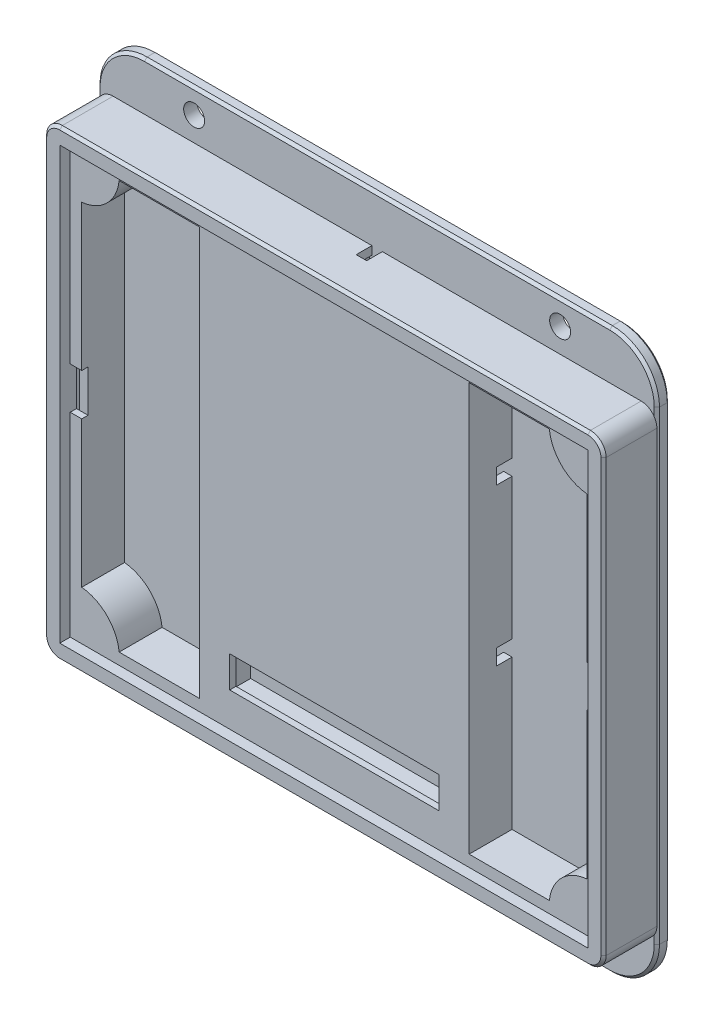
from build123d import *

# Parameters (mm, degrees)
SKETCH1_W                 = 107
SKETCH1_H                 = 88.5
SKETCH1_W_2               = 101
SKETCH1_H_2               = 82.5
BOSS_EXTRUDE1_DEPTH       = 2
FILLET1_R                 = 3
CHAMFER1_SIZE             = 0.5
SKETCH2_W                 = 8
SKETCH2_H                 = 8
SKETCH2_W_2               = 40
SKETCH2_H_2               = 6
BOSS_EXTRUDE2_DEPTH       = 1.2
BOSS_EXTRUDE3_DEPTH       = 7
EXTRUDE_THIN1_OUTLINE_W   = 48.4
EXTRUDE_THIN1_OUTLINE_H   = 21
EXTRUDE_THIN1_OUTLINE_H_2 = 5.75
EXTRUDE_THIN1_OUTLINE_H_3 = 12.4
EXTRUDE_THIN1_DEPTH       = 7
SKETCH6_R                 = 1.4
BOSS_EXTRUDE4_DEPTH       = 7
MIRROR2_COPY_1_SKETCH_R   = 1.4
MIRROR2_COPY_1_DEPTH      = 7
EXTRUDE_THIN2_DEPTH       = 7
SKETCH10_W                = 51.6
SKETCH10_H                = 1.6
BOSS_EXTRUDE5_DEPTH       = 7
SKETCH11_W                = 51.6
SKETCH11_H                = 2
CUT_EXTRUDE1_DEPTH        = 7
CUT_EXTRUDE2_DEPTH        = 70.780459299
EXTRUDE_THIN3_DEPTH       = 4
FILLET2_R                 = 1.6
SKETCH14_R                = 1.5
SKETCH14_R_2              = 1.8
BOSS_EXTRUDE6_DEPTH       = 2.5
CHAMFER2_SIZE             = 0.5
SKETCH15_W                = 2
SKETCH15_H                = 3
CUT_EXTRUDE3_DEPTH        = 14
SKETCH16_W                = 107
SKETCH16_H                = 107
SKETCH16_R                = 2
BOSS_EXTRUDE7_DEPTH       = 2.5
FILLET3_R                 = 9
CHAMFER3_SIZE             = 0.5
SKETCH17_W                = 1.6
SKETCH17_H                = 3
CUT_EXTRUDE4_DEPTH        = 3
SKETCH18_W                = 3
SKETCH18_H                = 4
CUT_EXTRUDE5_DEPTH        = 1.2
CHAMFER4_SIZE             = 1.5


# Read off the part's stored shape, not the designer's step: Extrude-Thin1, DeleteFace1
with BuildPart() as part:
    # Sketch1 → Boss-Extrude1 (new body)
    with BuildSketch(Plane.XY):
        Rectangle(SKETCH1_W, SKETCH1_H)
        Rectangle(SKETCH1_W_2, SKETCH1_H_2, mode=Mode.SUBTRACT)
    extrude(amount=BOSS_EXTRUDE1_DEPTH)

    # Fillet1
    fillet1_edges = [part.edges().sort_by_distance(p)[0] for p in [
        (-53.5, 44.25, 1),
        (53.5, 44.25, 1),
        (53.5, -44.25, 1),
        (-53.5, -44.25, 1),
    ]]
    fillet(fillet1_edges, radius=FILLET1_R)

    # Chamfer1
    chamfer1_edges = [part.edges().sort_by_distance(p)[0] for p in [
        (53.5, 0, 2),
        (0, -44.25, 2),
        (-53.5, 0, 2),
        (0, 44.25, 2),
        (52.621320344, 43.371320344, 2),
        (-52.621320344, 43.371320344, 2),
        (-52.621320344, -43.371320344, 2),
        (52.621320344, -43.371320344, 2),
    ]]
    chamfer(chamfer1_edges, length=CHAMFER1_SIZE)

    # Sketch2 → Boss-Extrude2 (add)
    with BuildSketch(Plane(origin=(0, 0, 0), x_dir=(-1, 0, 0), z_dir=(0, 0, -1))):
        with BuildLine():
            Line((-53.5, 41.25), (-53.5, -41.25))
            ThreePointArc((-53.5, -41.25), (-52.621320344, -43.371320344), (-50.5, -44.25))
            Line((-50.5, -44.25), (50.5, -44.25))
            ThreePointArc((50.5, -44.25), (52.621320344, -43.371320344), (53.5, -41.25))
            Line((53.5, -41.25), (53.5, 41.25))
            ThreePointArc((53.5, 41.25), (52.621320344, 43.371320344), (50.5, 44.25))
            Line((50.5, 44.25), (-50.5, 44.25))
            ThreePointArc((-50.5, 44.25), (-52.621320344, 43.371320344), (-53.5, 41.25))
        make_face()
        with Locations((-46.5, 0)):
            Rectangle(SKETCH2_W, SKETCH2_H, mode=Mode.SUBTRACT)
        with Locations((46.5, 0)):
            Rectangle(SKETCH2_W, SKETCH2_H, mode=Mode.SUBTRACT)
        with Locations((0, -31.75)):
            Rectangle(SKETCH2_W_2, SKETCH2_H_2, mode=Mode.SUBTRACT)
    extrude(amount=BOSS_EXTRUDE2_DEPTH)

    # Sketch3 → Boss-Extrude3 (add)
    with BuildSketch(Plane(origin=(0, 0, -1.2), x_dir=(-1, 0, 0), z_dir=(0, 0, -1))):
        with BuildLine():
            Line((-53.5, 41.25), (-53.5, -41.25))
            ThreePointArc((-53.5, -41.25), (-52.621320344, -43.371320344), (-50.5, -44.25))
            Line((-50.5, -44.25), (50.5, -44.25))
            ThreePointArc((50.5, -44.25), (52.621320344, -43.371320344), (53.5, -41.25))
            Line((53.5, -41.25), (53.5, 41.25))
            ThreePointArc((53.5, 41.25), (52.621320344, 43.371320344), (50.5, 44.25))
            Line((50.5, 44.25), (-50.5, 44.25))
            ThreePointArc((-50.5, 44.25), (-52.621320344, 43.371320344), (-53.5, 41.25))
        make_face()
        with BuildLine():
            Line((50.5, 42.65), (-50.5, 42.65))
            ThreePointArc((-50.5, 42.65), (-51.489949494, 42.239949494), (-51.9, 41.25))
            Line((-51.9, 41.25), (-51.9, -41.25))
            ThreePointArc((-51.9, -41.25), (-51.489949494, -42.239949494), (-50.5, -42.65))
            Line((-50.5, -42.65), (50.5, -42.65))
            ThreePointArc((50.5, -42.65), (51.489949494, -42.239949494), (51.9, -41.25))
            Line((51.9, -41.25), (51.9, 41.25))
            ThreePointArc((51.9, 41.25), (51.489949494, 42.239949494), (50.5, 42.65))
        make_face(mode=Mode.SUBTRACT)
    extrude(amount=BOSS_EXTRUDE3_DEPTH)

    # Extrude-Thin1 outline → Extrude-Thin1 (add)
    with BuildSketch(Plane(origin=(0, 0, -1.2), x_dir=(-1, 0, 0), z_dir=(0, 0, -1))):
        Polygon((24.2, 42.65), (24.2, 33.45), (-24.2, 33.45), (-24.2, 42.65), (-25.8, 42.65), (-25.8, -42.65), (-24.2, -42.65), (-24.2, -12.1), (24.2, -12.1), (24.2, -42.65), (25.8, -42.65), (25.8, 42.65), align=None)
        Rectangle(EXTRUDE_THIN1_OUTLINE_W, EXTRUDE_THIN1_OUTLINE_H, mode=Mode.SUBTRACT)
        with Locations((0, 14.975)):
            Rectangle(EXTRUDE_THIN1_OUTLINE_W, EXTRUDE_THIN1_OUTLINE_H_2, mode=Mode.SUBTRACT)
        with Locations((0, 25.65)):
            Rectangle(EXTRUDE_THIN1_OUTLINE_W, EXTRUDE_THIN1_OUTLINE_H_3, mode=Mode.SUBTRACT)
    extrude(amount=EXTRUDE_THIN1_DEPTH)

    # Sketch6 → Boss-Extrude4 (add)
    with BuildSketch(Plane(origin=(0, 0, -8.2), x_dir=(-1, 0, 0), z_dir=(0, 0, -1))):
        with BuildLine():
            Line((-44.7, 39.85), (-44.7, 44.25))
            Line((-44.7, 44.25), (-49.1, 44.25))
            ThreePointArc((-49.1, 44.25), (-52.211269837, 42.961269837), (-53.5, 39.85))
            Line((-53.5, 39.85), (-53.5, 35.45))
            Line((-53.5, 35.45), (-49.1, 35.45))
            ThreePointArc((-49.1, 35.45), (-45.988730163, 36.738730163), (-44.7, 39.85))
        make_face()
        with Locations((-49.1, 39.85)):
            Circle(SKETCH6_R, mode=Mode.SUBTRACT)
    boss_extrude4 = extrude(amount=-BOSS_EXTRUDE4_DEPTH)

    # Mirror1: Boss-Extrude4 across plane
    add(boss_extrude4.mirror(Plane.ZX))

    # Mirror2: Boss-Extrude4 across plane
    add(boss_extrude4.mirror(Plane(origin=(0, 0, 0), x_dir=(0, 0, 1), z_dir=(1, 0, 0))))

    # Mirror2 copy 1 sketch → Mirror2 copy 1 (add)
    with BuildSketch(Plane(origin=(0, 0, -8.2), x_dir=(1, 0, 0), z_dir=(0, 0, -1))):
        with BuildLine():
            Line((-44.7, 39.85), (-44.7, 44.25))
            Line((-44.7, 44.25), (-49.1, 44.25))
            ThreePointArc((-49.1, 44.25), (-52.211269837, 42.961269837), (-53.5, 39.85))
            Line((-53.5, 39.85), (-53.5, 35.45))
            Line((-53.5, 35.45), (-49.1, 35.45))
            ThreePointArc((-49.1, 35.45), (-45.988730163, 36.738730163), (-44.7, 39.85))
        make_face()
        with Locations((-49.1, 39.85)):
            Circle(MIRROR2_COPY_1_SKETCH_R, mode=Mode.SUBTRACT)
    extrude(amount=-MIRROR2_COPY_1_DEPTH)

    # Sketch9 → Extrude-Thin2 (add)
    with BuildSketch(Plane(origin=(0, 0, -8.2), x_dir=(-1, 0, 0), z_dir=(0, 0, -1))):
        with BuildLine():
            Line((-25.8, 40.65), (-42.750196853, 40.65))
            ThreePointArc((-42.750196853, 40.65), (-44.5745166, 35.3245166), (-49.9, 33.500196853))
            Line((-49.9, 33.500196853), (-49.9, -33.500196853))
            ThreePointArc((-49.9, -33.500196853), (-44.5745166, -35.3245166), (-42.750196853, -40.65))
            Line((-42.750196853, -40.65), (-25.8, -40.65))
            Line((-25.8, -40.65), (-25.8, -39.05))
            Line((-25.8, -39.05), (-41.140100503, -39.05))
            ThreePointArc((-41.140100503, -39.05), (-43.443145751, -34.193145751), (-48.3, -31.890100503))
            Line((-48.3, -31.890100503), (-48.3, 31.890100503))
            ThreePointArc((-48.3, 31.890100503), (-43.443145751, 34.193145751), (-41.140100503, 39.05))
            Line((-41.140100503, 39.05), (-25.8, 39.05))
            Line((-25.8, 39.05), (-25.8, 40.65))
        make_face()
    extrude_thin2 = extrude(amount=-EXTRUDE_THIN2_DEPTH)

    # Mirror3: Extrude-Thin2 across plane
    add(extrude_thin2.mirror(Plane(origin=(0, 0, 0), x_dir=(0, 0, 1), z_dir=(1, 0, 0))))

    # Sketch10 → Boss-Extrude5 (add)
    with BuildSketch(Plane(origin=(0, 0, -8.2), x_dir=(-1, 0, 0), z_dir=(0, 0, -1))):
        with Locations((0, 39.85)):
            Rectangle(SKETCH10_W, SKETCH10_H)
        with Locations((0, -39.85)):
            Rectangle(SKETCH10_W, SKETCH10_H)
    extrude(amount=-BOSS_EXTRUDE5_DEPTH)

    # Sketch11 → Cut-Extrude1 (cut)
    with BuildSketch(Plane(origin=(0, 0, -8.2), x_dir=(-1, 0, 0), z_dir=(0, 0, -1))):
        with Locations((0, 41.65)):
            Rectangle(SKETCH11_W, SKETCH11_H)
        with Locations((0, -41.65)):
            Rectangle(SKETCH11_W, SKETCH11_H)
        with BuildLine():
            Line((-41.140100503, -39.05), (-25.8, -39.05))
            Line((-25.8, -39.05), (-25.8, 39.05))
            Line((-25.8, 39.05), (-41.140100503, 39.05))
            ThreePointArc((-41.140100503, 39.05), (-43.443145751, 34.193145751), (-48.3, 31.890100503))
            Line((-48.3, 31.890100503), (-48.3, 4))
            Line((-48.3, 4), (-42.5, 4))
            Line((-42.5, 4), (-42.5, -4))
            Line((-42.5, -4), (-48.3, -4))
            Line((-48.3, -4), (-48.3, -31.890100503))
            ThreePointArc((-48.3, -31.890100503), (-43.443145751, -34.193145751), (-41.140100503, -39.05))
        make_face()
        with BuildLine():
            Line((48.3, -31.890100503), (48.3, -4))
            Line((48.3, -4), (42.5, -4))
            Line((42.5, -4), (42.5, 4))
            Line((42.5, 4), (48.3, 4))
            Line((48.3, 4), (48.3, 31.890100503))
            ThreePointArc((48.3, 31.890100503), (43.443145751, 34.193145751), (41.140100503, 39.05))
            Line((41.140100503, 39.05), (25.8, 39.05))
            Line((25.8, 39.05), (25.8, -39.05))
            Line((25.8, -39.05), (41.140100503, -39.05))
            ThreePointArc((41.140100503, -39.05), (43.443145751, -34.193145751), (48.3, -31.890100503))
        make_face()
    extrude(amount=-CUT_EXTRUDE1_DEPTH, mode=Mode.SUBTRACT)

    # Sketch12 → Cut-Extrude2 (cut, through all)
    with BuildSketch(Plane(origin=(0, 0, -1.2), x_dir=(-1, 0, 0), z_dir=(0, 0, -1))):
        with BuildLine():
            Line((48.3, -31.890100503), (48.3, -4))
            Line((48.3, -4), (42.5, -4))
            Line((42.5, -4), (42.5, 4))
            Line((42.5, 4), (48.3, 4))
            Line((48.3, 4), (48.3, 31.890100503))
            ThreePointArc((48.3, 31.890100503), (43.443145751, 34.193145751), (41.140100503, 39.05))
            Line((41.140100503, 39.05), (25.8, 39.05))
            Line((25.8, 39.05), (25.8, -39.05))
            Line((25.8, -39.05), (41.140100503, -39.05))
            ThreePointArc((41.140100503, -39.05), (43.443145751, -34.193145751), (48.3, -31.890100503))
        make_face()
        with BuildLine():
            Line((-41.140100503, -39.05), (-25.8, -39.05))
            Line((-25.8, -39.05), (-25.8, 39.05))
            Line((-25.8, 39.05), (-41.140100503, 39.05))
            ThreePointArc((-41.140100503, 39.05), (-43.443145751, 34.193145751), (-48.3, 31.890100503))
            Line((-48.3, 31.890100503), (-48.3, 4))
            Line((-48.3, 4), (-42.5, 4))
            Line((-42.5, 4), (-42.5, -4))
            Line((-42.5, -4), (-48.3, -4))
            Line((-48.3, -4), (-48.3, -31.890100503))
            ThreePointArc((-48.3, -31.890100503), (-43.443145751, -34.193145751), (-41.140100503, -39.05))
        make_face()
    extrude(amount=-CUT_EXTRUDE2_DEPTH, mode=Mode.SUBTRACT)

    # Sketch15 → Cut-Extrude3 (cut)
    with BuildSketch(Plane(origin=(0, 44.25, 0), x_dir=(1, 0, 0), z_dir=(0, 1, 0))):
        with Locations((0, 6.7)):
            Rectangle(SKETCH15_W, SKETCH15_H)
    extrude(amount=-CUT_EXTRUDE3_DEPTH, mode=Mode.SUBTRACT)

    # Sketch17 → Cut-Extrude4 (cut)
    with BuildSketch(Plane(origin=(0, 0, -8.2), x_dir=(-1, 0, 0), z_dir=(0, 0, -1))):
        Polygon((24.2, -7.5), (24.2, 19.45), (21.2, 19.45), (21.2, -12.1), (24.2, -12.1), (24.2, -10.5), align=None)
        with Locations((25, 20.95)):
            Rectangle(SKETCH17_W, SKETCH17_H)
        with Locations((25, -9)):
            Rectangle(SKETCH17_W, SKETCH17_H)
        Polygon((-21.2, 19.45), (-24.2, 19.45), (-24.2, -7.5), (-24.2, -10.5), (-24.2, -12.1), (-21.2, -12.1), align=None)
        with Locations((-25, 20.95)):
            Rectangle(SKETCH17_W, SKETCH17_H)
        with Locations((-25, -9)):
            Rectangle(SKETCH17_W, SKETCH17_H)
    extrude(amount=-CUT_EXTRUDE4_DEPTH, mode=Mode.SUBTRACT)


with BuildPart() as body_2:
    # Sketch13 → Extrude-Thin3 (new body)
    with BuildSketch(Plane(origin=(0, 0, -8.2), x_dir=(-1, 0, 0), z_dir=(0, 0, -1))):
        with BuildLine():
            Line((44.943078062, 42.25), (-44.943078062, 42.25))
            ThreePointArc((-44.943078062, 42.25), (-45.70588745, 36.45588745), (-51.5, 35.693078062))
            Line((-51.5, 35.693078062), (-51.5, -35.693078062))
            ThreePointArc((-51.5, -35.693078062), (-45.70588745, -36.45588745), (-44.943078062, -42.25))
            Line((-44.943078062, -42.25), (44.943078062, -42.25))
            ThreePointArc((44.943078062, -42.25), (45.70588745, -36.45588745), (51.5, -35.693078062))
            Line((51.5, -35.693078062), (51.5, 35.693078062))
            ThreePointArc((51.5, 35.693078062), (45.70588745, 36.45588745), (44.943078062, 42.25))
        make_face()
        with BuildLine():
            Line((43.221224617, 41.05), (-43.221224617, 41.05))
            ThreePointArc((-43.221224617, 41.05), (-44.857359313, 35.607359313), (-50.3, 33.971224617))
            Line((-50.3, 33.971224617), (-50.3, -33.971224617))
            ThreePointArc((-50.3, -33.971224617), (-44.857359313, -35.607359313), (-43.221224617, -41.05))
            Line((-43.221224617, -41.05), (43.221224617, -41.05))
            ThreePointArc((43.221224617, -41.05), (44.857359313, -35.607359313), (50.3, -33.971224617))
            Line((50.3, -33.971224617), (50.3, 33.971224617))
            ThreePointArc((50.3, 33.971224617), (44.857359313, 35.607359313), (43.221224617, 41.05))
        make_face(mode=Mode.SUBTRACT)
    extrude(amount=-EXTRUDE_THIN3_DEPTH)

    # Fillet2
    fillet2_edges = [body_2.edges().sort_by_distance(p)[0] for p in [
        (-44.943078062, 42.25, -6.2),
        (-51.5, 35.693078062, -6.2),
        (-51.5, -35.693078062, -6.2),
        (-44.943078062, -42.25, -6.2),
        (44.943078062, -42.25, -6.2),
        (51.5, -35.693078062, -6.2),
        (51.5, 35.693078062, -6.2),
        (44.943078062, 42.25, -6.2),
    ]]
    fillet(fillet2_edges, radius=FILLET2_R)

    # Sketch14 → Boss-Extrude6 (add)
    with BuildSketch(Plane(origin=(0, 0, -8.2), x_dir=(-1, 0, 0), z_dir=(0, 0, -1))):
        with BuildLine():
            Line((-50.5, -44.25), (50.5, -44.25))
            ThreePointArc((50.5, -44.25), (52.621320344, -43.371320344), (53.5, -41.25))
            Line((53.5, -41.25), (53.5, 41.25))
            ThreePointArc((53.5, 41.25), (52.621320344, 43.371320344), (50.5, 44.25))
            Line((50.5, 44.25), (-50.5, 44.25))
            ThreePointArc((-50.5, 44.25), (-52.621320344, 43.371320344), (-53.5, 41.25))
            Line((-53.5, 41.25), (-53.5, -41.25))
            ThreePointArc((-53.5, -41.25), (-52.621320344, -43.371320344), (-50.5, -44.25))
        make_face()
        with Locations((9.2, 28.85)):
            Circle(SKETCH14_R, mode=Mode.SUBTRACT)
        with Locations((-49.1, 39.85)):
            Circle(SKETCH14_R_2, mode=Mode.SUBTRACT)
        with Locations((49.1, 39.85)):
            Circle(SKETCH14_R_2, mode=Mode.SUBTRACT)
        with Locations((49.1, -39.85)):
            Circle(SKETCH14_R_2, mode=Mode.SUBTRACT)
        with Locations((-49.1, -39.85)):
            Circle(SKETCH14_R_2, mode=Mode.SUBTRACT)
    extrude(amount=BOSS_EXTRUDE6_DEPTH)

    # Chamfer2
    chamfer2_edges = [body_2.edges().sort_by_distance(p)[0] for p in [
        (-7.7, 28.85, -10.7),
        (50.9, 39.85, -10.7),
        (-47.3, 39.85, -10.7),
        (-47.3, -39.85, -10.7),
        (50.9, -39.85, -10.7),
        (52.621320344, -43.371320344, -10.7),
        (0, -44.25, -10.7),
        (-52.621320344, -43.371320344, -10.7),
        (-53.5, 0, -10.7),
        (-52.621320344, 43.371320344, -10.7),
        (0, 44.25, -10.7),
        (52.621320344, 43.371320344, -10.7),
        (53.5, 0, -10.7),
    ]]
    chamfer(chamfer2_edges, length=CHAMFER2_SIZE)

    # Sketch16 → Boss-Extrude7 (add)
    with BuildSketch(Plane(origin=(0, 0, -10.7), x_dir=(-1, 0, 0), z_dir=(0, 0, -1))):
        Rectangle(SKETCH16_W, SKETCH16_H)
        with Locations((-35, -48.875)):
            Circle(SKETCH16_R, mode=Mode.SUBTRACT)
        with Locations((35, -48.875)):
            Circle(SKETCH16_R, mode=Mode.SUBTRACT)
        with Locations((35, 48.875)):
            Circle(SKETCH16_R, mode=Mode.SUBTRACT)
        with Locations((-35, 48.875)):
            Circle(SKETCH16_R, mode=Mode.SUBTRACT)
        with BuildLine():
            Line((53, -41.25), (53, 41.25))
            ThreePointArc((53, 41.25), (52.267766953, 43.017766953), (50.5, 43.75))
            Line((50.5, 43.75), (-50.5, 43.75))
            ThreePointArc((-50.5, 43.75), (-52.267766953, 43.017766953), (-53, 41.25))
            Line((-53, 41.25), (-53, -41.25))
            ThreePointArc((-53, -41.25), (-52.267766953, -43.017766953), (-50.5, -43.75))
            Line((-50.5, -43.75), (50.5, -43.75))
            ThreePointArc((50.5, -43.75), (52.267766953, -43.017766953), (53, -41.25))
        make_face(mode=Mode.SUBTRACT)
    extrude(amount=-BOSS_EXTRUDE7_DEPTH)

    # Fillet3
    fillet3_edges = [body_2.edges().sort_by_distance(p)[0] for p in [
        (-53.5, 53.5, -9.45),
        (53.5, 53.5, -9.45),
        (53.5, -53.5, -9.45),
        (-53.5, -53.5, -9.45),
    ]]
    fillet(fillet3_edges, radius=FILLET3_R)

    # Chamfer3
    chamfer3_edges = [body_2.edges().sort_by_distance(p)[0] for p in [
        (53.5, 0, -8.2),
        (53.5, 0, -10.7),
        (-53.5, 0, -10.7),
        (0, 53.5, -10.7),
        (0, -53.5, -10.7),
        (50.863961031, 50.863961031, -10.7),
        (-50.863961031, 50.863961031, -10.7),
        (-50.863961031, -50.863961031, -10.7),
        (50.863961031, -50.863961031, -10.7),
        (0, -53.5, -8.2),
        (0, 53.5, -8.2),
        (-53.5, 0, -8.2),
        (50.863961031, 50.863961031, -8.2),
        (-50.863961031, 50.863961031, -8.2),
        (-50.863961031, -50.863961031, -8.2),
        (50.863961031, -50.863961031, -8.2),
    ]]
    chamfer(chamfer3_edges, length=CHAMFER3_SIZE)

    # Sketch18 → Cut-Extrude5 (cut)
    with BuildSketch(Plane(origin=(0, 42.25, 0), x_dir=(1, 0, 0), z_dir=(0, 1, 0))):
        with Locations((0, 6.2)):
            Rectangle(SKETCH18_W, SKETCH18_H)
    extrude(amount=-CUT_EXTRUDE5_DEPTH, mode=Mode.SUBTRACT)

    # DeleteFace1 outline → DeleteFace1 (revolve)
    with BuildSketch(Plane(origin=(49.1, -39.85, 0), x_dir=(1, 0, 0), z_dir=(0, -1, 0))):
        Polygon((2.3, -10.7), (1.8, -10.2), (1.8, -10.7), align=None)
    revolve(axis=Axis((49.1, -39.85, 0), (0, 0, 1)))

    # DeleteFace1 2 outline → DeleteFace1 2 (revolve)
    with BuildSketch(Plane(origin=(-49.1, 39.85, 0), x_dir=(1, 0, 0), z_dir=(0, -1, 0))):
        Polygon((2.3, -10.7), (1.8, -10.2), (1.8, -10.7), align=None)
    revolve(axis=Axis((-49.1, 39.85, 0), (0, 0, 1)))

    # DeleteFace1 3 outline → DeleteFace1 3 (revolve)
    with BuildSketch(Plane(origin=(49.1, 39.85, 0), x_dir=(1, 0, 0), z_dir=(0, -1, 0))):
        Polygon((2.3, -10.7), (1.8, -10.2), (1.8, -10.7), align=None)
    revolve(axis=Axis((49.1, 39.85, 0), (0, 0, 1)))

    # DeleteFace1 4 outline → DeleteFace1 4 (revolve)
    with BuildSketch(Plane(origin=(-49.1, -39.85, 0), x_dir=(1, 0, 0), z_dir=(0, -1, 0))):
        Polygon((2.3, -10.7), (1.8, -10.2), (1.8, -10.7), align=None)
    revolve(axis=Axis((-49.1, -39.85, 0), (0, 0, 1)))

    # Chamfer4
    chamfer4_edges = [body_2.edges().sort_by_distance(p)[0] for p in [
        (47.3, -39.85, -10.7),
        (-50.9, 39.85, -10.7),
        (47.3, 39.85, -10.7),
        (-50.9, -39.85, -10.7),
    ]]
    chamfer(chamfer4_edges, length=CHAMFER4_SIZE)


solid = Compound([part.part, body_2.part])
